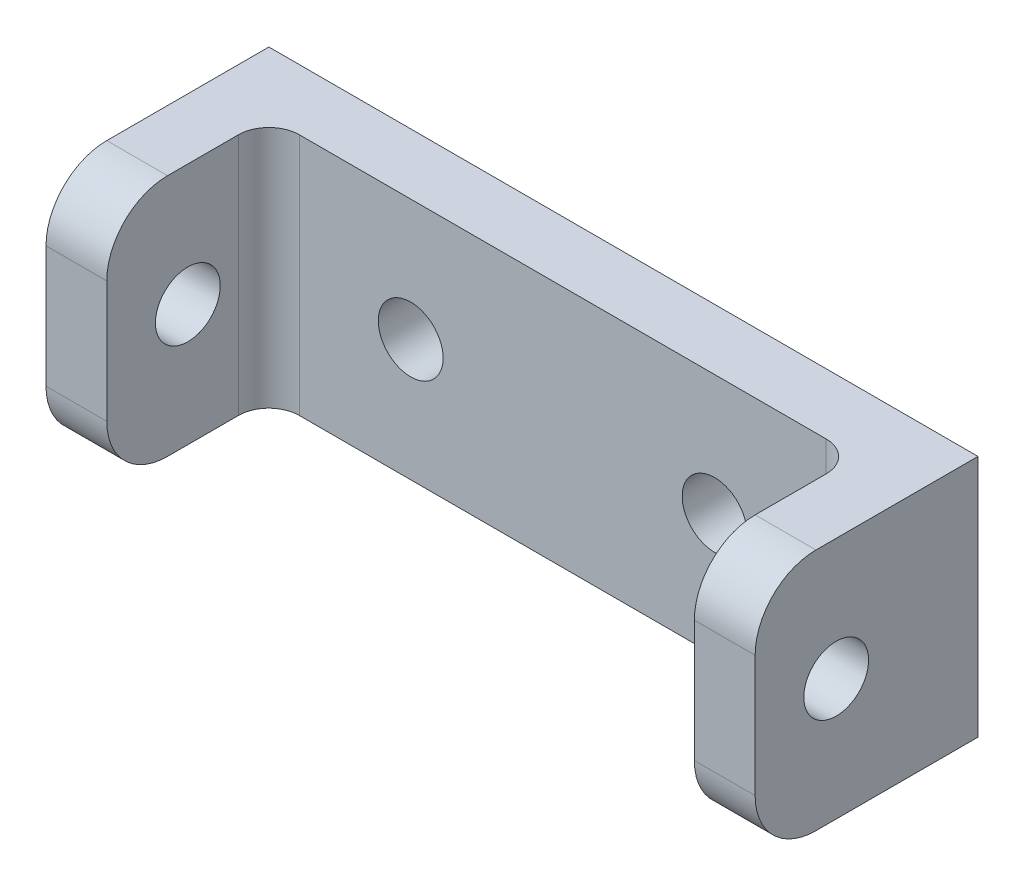
from build123d import *

# Parameters (mm, degrees)
SKETCH_1_W             = 35
SKETCH_1_H             = 12
EXTRUDE_1_DEPTH        = 3
SKETCH_2_W             = 8
SKETCH_2_H             = 12
EXTRUDE_2_DEPTH        = 3
FILLET_1_R             = 3
FILLET_2_R             = 1.5
SKETCH_3_R             = 1.6
CUT_EXTRUDE_1_DEPTH    = 3
SKETCH_4_R             = 1.6
CUT_EXTRUDE_2_DEPTH    = 3
FILLET_1_OF_MIRROR_1_R = 3
FILLET_2_OF_MIRROR_1_R = 1.5


with BuildPart() as part:
    # 草图1 → 凸台-拉伸1 (new body)
    with BuildSketch(Plane.XY):
        with Locations((0, -24)):
            Rectangle(SKETCH_1_W, SKETCH_1_H)
    extrude(amount=EXTRUDE_1_DEPTH)

    # 草图2 → 凸台-拉伸2 (add)
    with BuildSketch(Plane.ZY.offset(17.5)):
        with Locations((7, -24)):
            Rectangle(SKETCH_2_W, SKETCH_2_H)
    extrude_2 = extrude(amount=-EXTRUDE_2_DEPTH)

    # 圆角1
    fillet_1_edges = [part.edges().sort_by_distance(p)[0] for p in [
        (-16, -18, 11),
        (-16, -30, 11),
    ]]
    fillet(fillet_1_edges, radius=FILLET_1_R)

    # 圆角2
    fillet_2_edges = [part.edges().sort_by_distance(p)[0] for p in [
        (-14.5, -24, 3),
    ]]
    fillet(fillet_2_edges, radius=FILLET_2_R)

    # 草图3 → 切除-拉伸1 (cut)
    with BuildSketch(Plane.ZY.offset(17.5)):
        with Locations((7, -24)):
            Circle(SKETCH_3_R)
    cut_extrude_1 = extrude(amount=-CUT_EXTRUDE_1_DEPTH, mode=Mode.SUBTRACT)

    # 草图4 → 切除-拉伸2 (cut)
    with BuildSketch(Plane.XY.offset(3)):
        with Locations((7.5, -24)):
            Circle(SKETCH_4_R)
        with Locations((-7.5, -24)):
            Circle(SKETCH_4_R)
    extrude(amount=-CUT_EXTRUDE_2_DEPTH, mode=Mode.SUBTRACT)

    # 镜向1: 凸台-拉伸2, 切除-拉伸1 across plane
    add(extrude_2.mirror(Plane(origin=(0, 0, 0), x_dir=(0, 0, 1), z_dir=(1, 0, 0))))
    add(cut_extrude_1.mirror(Plane(origin=(0, 0, 0), x_dir=(0, 0, 1), z_dir=(1, 0, 0))), mode=Mode.SUBTRACT)

    # 圆角1 of 镜向1
    fillet_1_of_mirror_1_edges = [part.edges().sort_by_distance(p)[0] for p in [
        (16, -18, 11),
        (16, -30, 11),
    ]]
    fillet(fillet_1_of_mirror_1_edges, radius=FILLET_1_OF_MIRROR_1_R)

    # 圆角2 of 镜向1
    fillet_2_of_mirror_1_edges = [part.edges().sort_by_distance(p)[0] for p in [
        (14.5, -24, 3),
    ]]
    fillet(fillet_2_of_mirror_1_edges, radius=FILLET_2_OF_MIRROR_1_R)


solid = part.part
